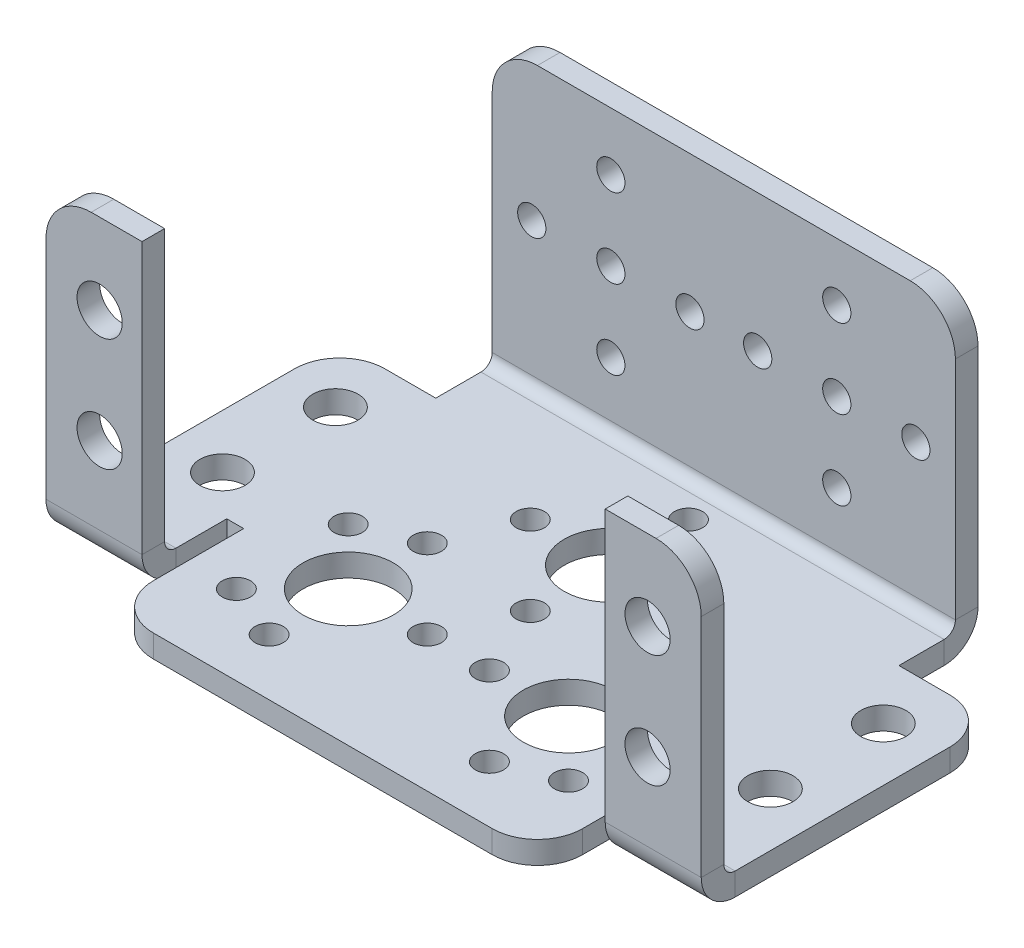
from build123d import *

# Parameters (mm, degrees)
T_LE_DE_BASE_PLI_E1_DEPTH             = 20.5
ESQUISSE8_W                           = 24
ESQUISSE8_H                           = 2
BOSS_EXTRU_1_DEPTH                    = 8.5
T_LE_PLI_E_SUR_AR_TE1_STRIP_W         = 10
T_LE_PLI_E_SUR_AR_TE1_STRIP_H         = 2
T_LE_PLI_E_SUR_AR_TE1_STRIP_CUT_DEPTH = 8.5
T_LE_PLI_E_SUR_AR_TE1_DEPTH           = 8.5
ESQUISSE12_W                          = 1.5
ESQUISSE12_H                          = 12
ENL_V_MAT_EXTRU_1_DEPTH               = 8.5
DIAM_TRE_DU_PER_AGE_4_0_4_1_D         = 4
DIAM_TRE_DU_PER_AGE_8_0_8_1_D         = 8
DIAM_TRE_DU_PER_AGE_2_5_2_5_1_D       = 2.5
R_P_TITION_CIRCULAIRE1_COUNT          = 8
DIAM_TRE_DU_PER_AGE_4_0_4_2_D         = 4
DIAM_TRE_DU_PER_AGE_2_5_2_5_2_D       = 2.5
CONG_1_R                              = 4
DIAM_TRE_DU_PER_AGE_8_0_8_2_D         = 8
DIAM_TRE_DU_PER_AGE_2_5_2_5_3_D       = 2.5
R_P_TITION_CIRCULAIRE2_COUNT          = 4
CUT_EXTRUDE1_DEPTH                    = 54.200093985
CUT_EXTRUDE1_DEPTH_BACK               = 54.200093985
SKETCH1_R                             = 1.25


# Sheet-metal steps are written as plain solids
with BuildPart() as part:
    # Esquisse1 → Tôle de base pliée1 (new body)
    with BuildSketch(Plane(origin=(0, 0, 0), x_dir=(0, 0, -1), z_dir=(1, 0, 0))):
        with BuildLine():
            Line((0, 27), (0, 3))
            ThreePointArc((0, 3), (-0.878679656, 0.878679656), (-3, 0))
            Line((-3, 0), (-37.5, 0))
            Line((-37.5, 0), (-37.5, 2))
            Line((-37.5, 2), (-3, 2))
            ThreePointArc((-3, 2), (-2.292893219, 2.292893219), (-2, 3))
            Line((-2, 3), (-2, 27))
            Line((-2, 27), (0, 27))
        make_face()
    extrude(amount=T_LE_DE_BASE_PLI_E1_DEPTH)

    # Esquisse8 → Boss.-Extru.1 (add)
    with BuildSketch(Plane(origin=(20.5, 0, 0), x_dir=(0, 0, -1), z_dir=(1, 0, 0))):
        with Locations((-19, 1)):
            Rectangle(ESQUISSE8_W, ESQUISSE8_H)
    extrude(amount=BOSS_EXTRU_1_DEPTH)

    # Tôle pliée sur arête1 strip (across the edge) → Tôle pliée sur arête1 strip cut (cut)
    with BuildSketch(Plane(origin=(20.5, 2, 31), x_dir=(0, 0, -1), z_dir=(1, 0, 0))):
        with Locations((-4, -1)):
            Rectangle(T_LE_PLI_E_SUR_AR_TE1_STRIP_W, T_LE_PLI_E_SUR_AR_TE1_STRIP_H)
    extrude(amount=T_LE_PLI_E_SUR_AR_TE1_STRIP_CUT_DEPTH, mode=Mode.SUBTRACT)

    # Tôle pliée sur arête1 section (across the edge) → Tôle pliée sur arête1 (add)
    with BuildSketch(Plane(origin=(20.5, 2, 31), x_dir=(0, 0, -1), z_dir=(1, 0, 0))):
        with BuildLine():
            Line((-2, 1), (-2, 25))
            Line((-2, 25), (0, 25))
            Line((0, 25), (0, 1))
            ThreePointArc((0, 1), (0.292893219, 0.292893219), (1, 0))
            Line((1, 0), (1, -2))
            ThreePointArc((1, -2), (-1.121320344, -1.121320344), (-2, 1))
        make_face()
    extrude(amount=T_LE_PLI_E_SUR_AR_TE1_DEPTH)

    # Esquisse12 → Enlèv. mat.-Extru.1 (cut)
    with BuildSketch(Plane(origin=(0, 2, 0), x_dir=(1, 0, 0), z_dir=(0, 1, 0))):
        with Locations((19.75, -31.5)):
            Rectangle(ESQUISSE12_W, ESQUISSE12_H)
    extrude(amount=-ENL_V_MAT_EXTRU_1_DEPTH, mode=Mode.SUBTRACT)

    # Diamètre du perçage Ø4.0 (4)1 (through all)
    with Locations(Plane(origin=(0, 2, 0), x_dir=(1, 0, 0), z_dir=(0, 1, 0))):
        with Locations((24.25, -12.13), (24.25, -22.13)):
            Hole(DIAM_TRE_DU_PER_AGE_4_0_4_1_D / 2)

    # Diamètre du perçage Ø8.0 (8)1 (through all)
    with Locations(Plane(origin=(0, 2, 0), x_dir=(1, 0, 0), z_dir=(0, 1, 0))):
        with Locations((9.75, -25.5)):
            Hole(DIAM_TRE_DU_PER_AGE_8_0_8_1_D / 2)

    # Diamètre du perçage Ø2.5 (2.5)1 (through all)
    with Locations(Plane(origin=(0, 2, 0), x_dir=(1, 0, 0), z_dir=(0, 1, 0))):
        with Locations((9.75, -18.5)):
            diam_tre_du_per_age_2_5_2_5_1 = Hole(DIAM_TRE_DU_PER_AGE_2_5_2_5_1_D / 2)

    # Répétition circulaire1: Diamètre du perçage Ø2.5 (2.5)1 ×8 about axis, 3 skipped
    r_p_tition_circulaire1_axis = Axis((9.75, 2, 25.5), (0, 1, 0))
    add([diam_tre_du_per_age_2_5_2_5_1.rotate(r_p_tition_circulaire1_axis, i * 360 / R_P_TITION_CIRCULAIRE1_COUNT) for i in range(1, R_P_TITION_CIRCULAIRE1_COUNT) if i not in (1, 3, 6)], mode=Mode.SUBTRACT)

    # Diamètre du perçage Ø4.0 (4)2 (through all)
    with Locations(Plane.XY.offset(33)):
        with Locations((24.25, 19.87), (24.25, 9.87)):
            Hole(DIAM_TRE_DU_PER_AGE_4_0_4_2_D / 2)

    # Diamètre du perçage Ø2.5 (2.5)2 (through all)
    with Locations(Plane.XY.offset(2)):
        with Locations((10, 14.87)):
            Hole(DIAM_TRE_DU_PER_AGE_2_5_2_5_2_D / 2)

    # Congé1
    cong_1_edges = [part.edges().sort_by_distance(p)[0] for p in [
        (20.5, 27, 1),
        (29, 1, 7),
        (29, 27, 32),
        (19, 1, 37.5),
    ]]
    fillet(cong_1_edges, radius=CONG_1_R)

    # Symétrie1: part across plane


with BuildPart() as part_1:
    add(part.part)
    add(part.part.mirror(Plane(origin=(0, 3, 3), x_dir=(0, 0, 1), z_dir=(1, 0, 0))))

    # Diamètre du perçage Ø8.0 (8)2 (through all)
    with Locations(Plane(origin=(0, 2, 0), x_dir=(1, 0, 0), z_dir=(0, 1, 0))):
        with Locations((0, -12.13)):
            Hole(DIAM_TRE_DU_PER_AGE_8_0_8_2_D / 2)

    # Diamètre du perçage Ø2.5 (2.5)3 (through all)
    with Locations(Plane(origin=(0, 2, 0), x_dir=(1, 0, 0), z_dir=(0, 1, 0))):
        with Locations((0, -5.13)):
            diam_tre_du_per_age_2_5_2_5_3 = Hole(DIAM_TRE_DU_PER_AGE_2_5_2_5_3_D / 2)

    # Répétition circulaire2: Diamètre du perçage Ø2.5 (2.5)3 ×4 about axis
    r_p_tition_circulaire2_axis = Axis((0, 0, 12.13), (0, 1, 0))
    for i in range(1, R_P_TITION_CIRCULAIRE2_COUNT):
        add(diam_tre_du_per_age_2_5_2_5_3.rotate(r_p_tition_circulaire2_axis, i * 360 / R_P_TITION_CIRCULAIRE2_COUNT), mode=Mode.SUBTRACT)

    # Sketch1 → Cut-Extrude1 (cut, two sides: drawn at the far end of the back side and taken through both)
    with BuildSketch(Plane.XY.offset(2).offset(-CUT_EXTRUDE1_DEPTH_BACK)):
        with Locations((-10, 21.87)):
            Circle(SKETCH1_R)
        with Locations((-3, 14.87)):
            Circle(SKETCH1_R)
        with Locations((-10, 7.87)):
            Circle(SKETCH1_R)
        with Locations((-17, 14.87)):
            Circle(SKETCH1_R)
        with Locations(Location((3, 14.87, 0), (0, 0, 90))):
            Circle(SKETCH1_R)
        with Locations(Location((10, 7.87, 0), (0, 0, 90))):
            Circle(SKETCH1_R)
        with Locations(Location((17, 14.87, 0), (0, 0, 90))):
            Circle(SKETCH1_R)
        with Locations(Location((10, 21.87, 0), (0, 0, 90))):
            Circle(SKETCH1_R)
    extrude(amount=CUT_EXTRUDE1_DEPTH + CUT_EXTRUDE1_DEPTH_BACK, mode=Mode.SUBTRACT)


solid = part_1.part
